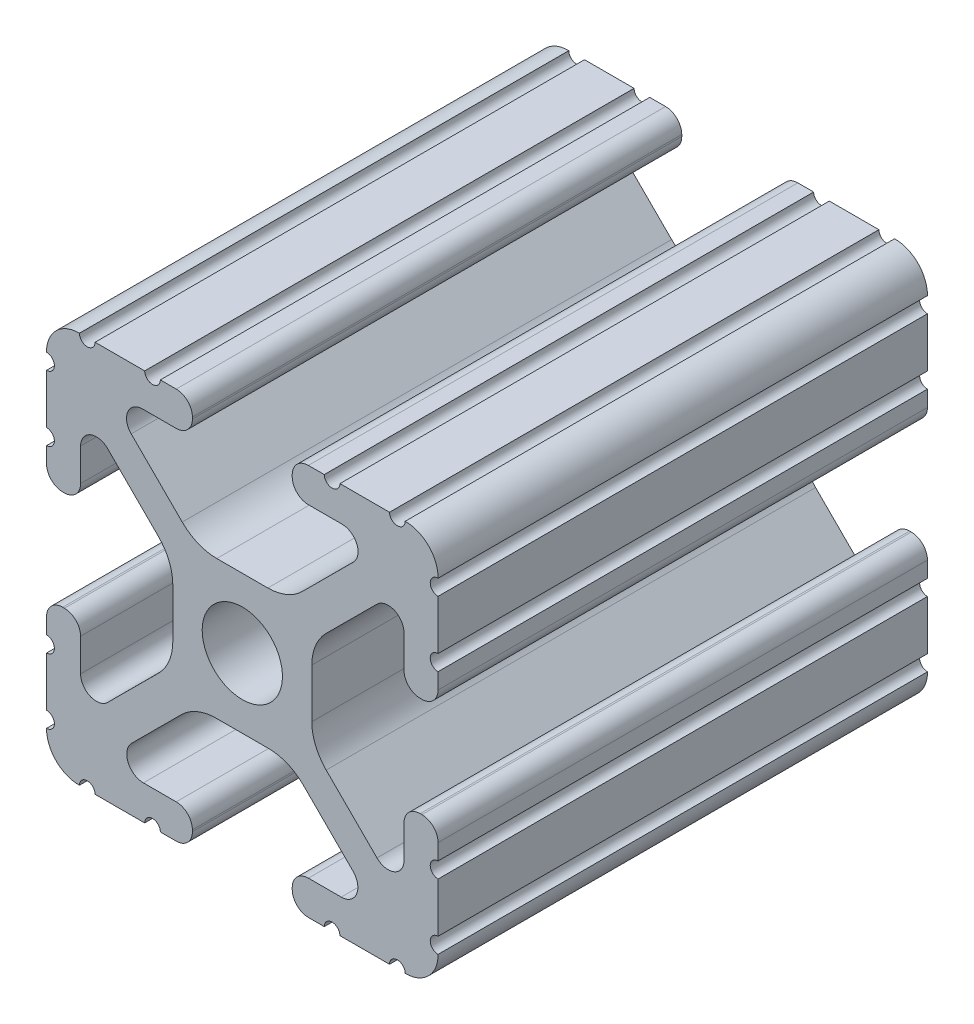
from build123d import *

# Parameters (mm, degrees)
SKETCH1_R           = 2.6035
BOSS_EXTRUDE1_DEPTH = 304.8
SKETCH2_R           = 24.282664684
CUT_EXTRUDE1_DEPTH  = 577.85


with BuildPart() as part:
    # Sketch1 → Boss-Extrude1 (new, symmetric)
    with BuildSketch(Plane.XY):
        with BuildLine():
            Line((-7.179650497, -8.645192506), (-3.952270251, -5.423690499))
            ThreePointArc((-3.952270251, -5.423690499), (-2.922936451, -4.736929036), (-1.709253557, -4.4958))
            Line((-1.709253557, -4.4958), (1.709253557, -4.4958))
            ThreePointArc((1.709253557, -4.4958), (2.922936451, -4.736929036), (3.952270251, -5.423690499))
            Line((3.952270251, -5.423690499), (7.179650497, -8.645192506))
            ThreePointArc((7.179650497, -8.645192506), (7.41473083, -9.822813117), (6.416408329, -10.4902))
            Line((6.416408329, -10.4902), (4.287512407, -10.4902))
            ThreePointArc((4.287512407, -10.4902), (3.54574862, -10.79744862), (3.2385, -11.539212407))
            Line((3.2385, -11.539212407), (3.2385, -11.650987593))
            ThreePointArc((3.2385, -11.650987593), (3.54574862, -12.39275138), (4.287512407, -12.7))
            Line((4.287512407, -12.7), (5.317126718, -12.7))
            ThreePointArc((5.317126718, -12.7), (5.825126718, -12.192), (6.333126718, -12.7))
            Line((6.333126718, -12.7), (9.550443118, -12.7))
            ThreePointArc((9.550443118, -12.7), (10.058366869, -12.192000006), (10.566443095, -12.699847501))
            ThreePointArc((10.566443095, -12.699847501), (12.082537762, -12.08250727), (12.699846982, -10.566399977))
            ThreePointArc((12.699846982, -10.566399977), (12.192000006, -10.058323491), (12.7, -9.5504))
            Line((12.7, -9.5504), (12.7, -6.3330836))
            ThreePointArc((12.7, -6.3330836), (12.192, -5.8250836), (12.7, -5.3170836))
            Line((12.7, -5.3170836), (12.7, -4.287469289))
            ThreePointArc((12.7, -4.287469289), (12.39275138, -3.545705502), (11.650987593, -3.238456882))
            Line((11.650987593, -3.238456882), (11.539212407, -3.238456882))
            ThreePointArc((11.539212407, -3.238456882), (10.79744862, -3.545705502), (10.4902, -4.287469289))
            Line((10.4902, -4.287469289), (10.4902, -6.402089023))
            ThreePointArc((10.4902, -6.402089023), (9.856505071, -7.351067942), (8.737131347, -7.129408934))
            Line((8.737131347, -7.129408934), (5.441005833, -3.840816462))
            ThreePointArc((5.441005833, -3.840816462), (4.750877967, -2.809883091), (4.5085, -1.593185507))
            Line((4.5085, -1.593185507), (4.5085, 1.593185507))
            ThreePointArc((4.5085, 1.593185507), (4.750877967, 2.809883091), (5.441005833, 3.840816462))
            Line((5.441005833, 3.840816462), (8.737131347, 7.129408934))
            ThreePointArc((8.737131347, 7.129408934), (9.856505071, 7.351067942), (10.4902, 6.402089023))
            Line((10.4902, 6.402089023), (10.4902, 4.287469289))
            ThreePointArc((10.4902, 4.287469289), (10.79744862, 3.545705502), (11.539212407, 3.238456882))
            Line((11.539212407, 3.238456882), (11.650987593, 3.238456882))
            ThreePointArc((11.650987593, 3.238456882), (12.39275138, 3.545705502), (12.7, 4.287469289))
            Line((12.7, 4.287469289), (12.7, 5.3170836))
            ThreePointArc((12.7, 5.3170836), (12.192, 5.8250836), (12.7, 6.3330836))
            Line((12.7, 6.3330836), (12.7, 9.5504))
            ThreePointArc((12.7, 9.5504), (12.192000006, 10.058323491), (12.699846982, 10.566399977))
            ThreePointArc((12.699846982, 10.566399977), (12.082537762, 12.08250727), (10.566443095, 12.699847501))
            ThreePointArc((10.566443095, 12.699847501), (10.058366869, 12.192000006), (9.550443118, 12.7))
            Line((9.550443118, 12.7), (6.333126718, 12.7))
            ThreePointArc((6.333126718, 12.7), (5.825126718, 12.192), (5.317126718, 12.7))
            Line((5.317126718, 12.7), (4.287512407, 12.7))
            ThreePointArc((4.287512407, 12.7), (3.54574862, 12.39275138), (3.2385, 11.650987593))
            Line((3.2385, 11.650987593), (3.2385, 11.539212407))
            ThreePointArc((3.2385, 11.539212407), (3.54574862, 10.79744862), (4.287512407, 10.4902))
            Line((4.287512407, 10.4902), (6.476788598, 10.4902))
            ThreePointArc((6.476788598, 10.4902), (7.432222385, 9.85140422), (7.207036008, 8.724370562))
            Line((7.207036008, 8.724370562), (3.898272566, 5.423169045))
            ThreePointArc((3.898272566, 5.423169045), (2.869120213, 4.736787962), (1.655778399, 4.4958))
            Line((1.655778399, 4.4958), (-1.655778399, 4.4958))
            ThreePointArc((-1.655778399, 4.4958), (-2.869120213, 4.736787962), (-3.898272566, 5.423169045))
            Line((-3.898272566, 5.423169045), (-7.207036008, 8.724370562))
            ThreePointArc((-7.207036008, 8.724370562), (-7.432222385, 9.85140422), (-6.476788598, 10.4902))
            Line((-6.476788598, 10.4902), (-4.287512407, 10.4902))
            ThreePointArc((-4.287512407, 10.4902), (-3.54574862, 10.79744862), (-3.2385, 11.539212407))
            Line((-3.2385, 11.539212407), (-3.2385, 11.650987593))
            ThreePointArc((-3.2385, 11.650987593), (-3.54574862, 12.39275138), (-4.287512407, 12.7))
            Line((-4.287512407, 12.7), (-5.317126718, 12.7))
            ThreePointArc((-5.317126718, 12.7), (-5.825126718, 12.192), (-6.333126718, 12.7))
            Line((-6.333126718, 12.7), (-9.550443118, 12.7))
            ThreePointArc((-9.550443118, 12.7), (-10.058366869, 12.192000006), (-10.566443095, 12.699847501))
            ThreePointArc((-10.566443095, 12.699847501), (-12.082537762, 12.08250727), (-12.699846982, 10.566399977))
            ThreePointArc((-12.699846982, 10.566399977), (-12.192000006, 10.058323491), (-12.7, 9.5504))
            Line((-12.7, 9.5504), (-12.7, 6.3330836))
            ThreePointArc((-12.7, 6.3330836), (-12.192, 5.8250836), (-12.7, 5.3170836))
            Line((-12.7, 5.3170836), (-12.7, 4.287469289))
            ThreePointArc((-12.7, 4.287469289), (-12.39275138, 3.545705502), (-11.650987593, 3.238456882))
            Line((-11.650987593, 3.238456882), (-11.539212407, 3.238456882))
            ThreePointArc((-11.539212407, 3.238456882), (-10.79744862, 3.545705502), (-10.4902, 4.287469289))
            Line((-10.4902, 4.287469289), (-10.4902, 6.402089023))
            ThreePointArc((-10.4902, 6.402089023), (-9.856505071, 7.351067942), (-8.737131347, 7.129408934))
            Line((-8.737131347, 7.129408934), (-5.441005833, 3.840816462))
            ThreePointArc((-5.441005833, 3.840816462), (-4.750877967, 2.809883091), (-4.5085, 1.593185507))
            Line((-4.5085, 1.593185507), (-4.5085, -1.593185507))
            ThreePointArc((-4.5085, -1.593185507), (-4.750877967, -2.809883091), (-5.441005833, -3.840816462))
            Line((-5.441005833, -3.840816462), (-8.737131347, -7.129408934))
            ThreePointArc((-8.737131347, -7.129408934), (-9.856505071, -7.351067942), (-10.4902, -6.402089023))
            Line((-10.4902, -6.402089023), (-10.4902, -4.287469289))
            ThreePointArc((-10.4902, -4.287469289), (-10.79744862, -3.545705502), (-11.539212407, -3.238456882))
            Line((-11.539212407, -3.238456882), (-11.650987593, -3.238456882))
            ThreePointArc((-11.650987593, -3.238456882), (-12.39275138, -3.545705502), (-12.7, -4.287469289))
            Line((-12.7, -4.287469289), (-12.7, -5.3170836))
            ThreePointArc((-12.7, -5.3170836), (-12.192, -5.8250836), (-12.7, -6.3330836))
            Line((-12.7, -6.3330836), (-12.7, -9.5504))
            ThreePointArc((-12.7, -9.5504), (-12.192000006, -10.058323491), (-12.699846982, -10.566399977))
            ThreePointArc((-12.699846982, -10.566399977), (-12.082537762, -12.08250727), (-10.566443095, -12.699847501))
            ThreePointArc((-10.566443095, -12.699847501), (-10.058366869, -12.192000006), (-9.550443118, -12.7))
            Line((-9.550443118, -12.7), (-6.333126718, -12.7))
            ThreePointArc((-6.333126718, -12.7), (-5.825126718, -12.192), (-5.317126718, -12.7))
            Line((-5.317126718, -12.7), (-4.287512407, -12.7))
            ThreePointArc((-4.287512407, -12.7), (-3.54574862, -12.39275138), (-3.2385, -11.650987593))
            Line((-3.2385, -11.650987593), (-3.2385, -11.539212407))
            ThreePointArc((-3.2385, -11.539212407), (-3.54574862, -10.79744862), (-4.287512407, -10.4902))
            Line((-4.287512407, -10.4902), (-6.416408329, -10.4902))
            ThreePointArc((-6.416408329, -10.4902), (-7.41473083, -9.822813117), (-7.179650497, -8.645192506))
        make_face()
        Circle(SKETCH1_R, mode=Mode.SUBTRACT)
    extrude(amount=BOSS_EXTRUDE1_DEPTH, both=True)

    # Sketch2 → Cut-Extrude1 (cut)
    with BuildSketch(Plane(origin=(0, 0, -304.8), x_dir=(-1, 0, 0), z_dir=(0, 0, -1))):
        Circle(SKETCH2_R)
    extrude(amount=-CUT_EXTRUDE1_DEPTH, mode=Mode.SUBTRACT)


solid = part.part
